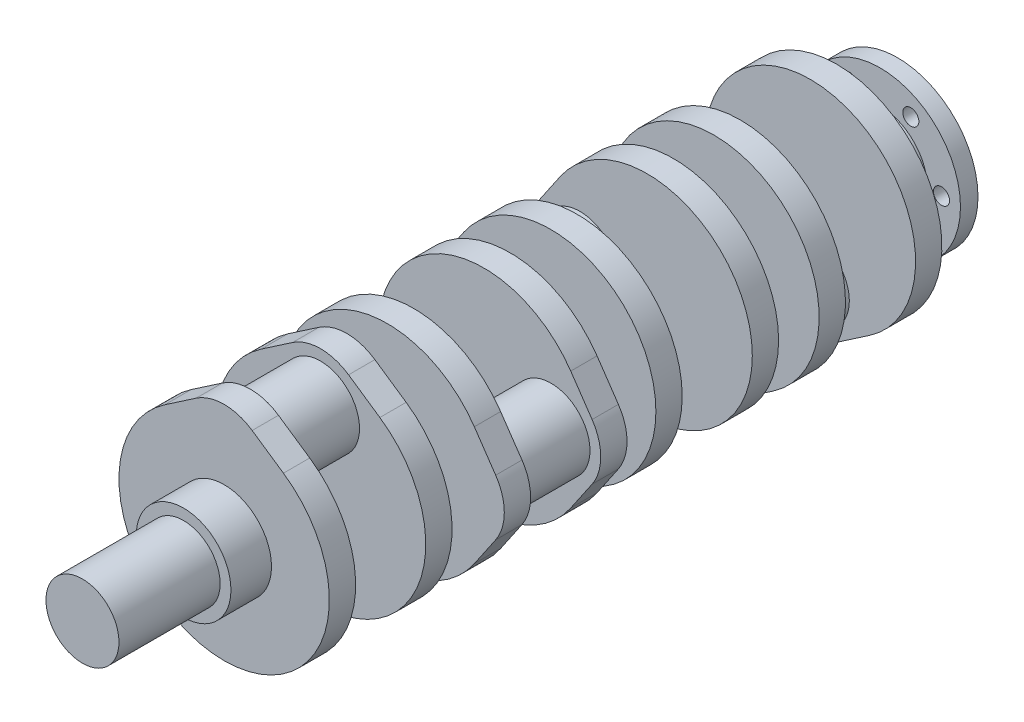
from build123d import *

# Parameters (mm, degrees)
MAIN_START              = 42
SKETCH1_R               = 32.4
MAIN_JOURNAL_1_DEPTH    = 27.76
MAIN_START_2            = -69.76
SKETCH2_R               = 32.4
MAIN_JOURNAL_2_DEPTH    = 27.76
MAIN_START_3            = -181.52
SKETCH3_R               = 32.4
MAIN_JOURNAL_3_DEPTH    = 27.76
MAIN_START_4            = -293.28
SKETCH4_R               = 32.4
MAIN_JOURNAL_4_DEPTH    = 27.76
MAIN_START_5            = -407
SKETCH5_R               = 32.4
MAIN_JOURNAL_5_DEPTH    = 29.72
SNOUT_START             = 69.76
SKETCH6_R               = 25
SNOUT_DEPTH             = 69.24
FLYWHEEL_START          = -419
SKETCH7_R               = 55
FLYWHEEL_FLANGE_DEPTH   = 12
ROD_START               = -24
SKETCH8_R               = 26.65
ROD_JOURNAL_1_DEPTH     = 48
WEB_START               = 24
WEB_1A_DEPTH            = 18
WEB_START_2             = -42
WEB_1B_DEPTH            = 18
ROD_START_2             = -135.76
SKETCH11_R              = 26.65
ROD_JOURNAL_2_DEPTH     = 48
WEB_START_3             = -87.76
WEB_2A_DEPTH            = 18
WEB_START_4             = -153.76
WEB_2B_DEPTH            = 18
ROD_START_3             = -247.52
SKETCH14_R              = 26.65
ROD_JOURNAL_3_DEPTH     = 48
WEB_START_5             = -199.52
WEB_3A_DEPTH            = 18
WEB_START_6             = -265.52
WEB_3B_DEPTH            = 18
ROD_START_4             = -359.28
SKETCH17_R              = 26.65
ROD_JOURNAL_4_DEPTH     = 48
WEB_START_7             = -311.28
WEB_4A_DEPTH            = 18
WEB_START_8             = -377.28
WEB_4B_DEPTH            = 18
FLANGE_START            = -420
SKETCH20_R              = 5.5
FLANGE_BOLT_HOLES_DEPTH = 13


with BuildPart() as part:
    # Sketch1 → Main Journal 1 (new body)
    with BuildSketch(Plane.XY.offset(MAIN_START)):
        Circle(SKETCH1_R)
    extrude(amount=MAIN_JOURNAL_1_DEPTH)

    # Sketch6 → Snout (add)
    with BuildSketch(Plane.XY.offset(SNOUT_START)):
        Circle(SKETCH6_R)
    extrude(amount=SNOUT_DEPTH)



with BuildPart() as body_2:
    # Sketch2 → Main Journal 2 (new body)
    with BuildSketch(Plane.XY.offset(MAIN_START_2)):
        Circle(SKETCH2_R)
    extrude(amount=MAIN_JOURNAL_2_DEPTH)


with BuildPart() as body_3:
    # Sketch3 → Main Journal 3 (new body)
    with BuildSketch(Plane.XY.offset(MAIN_START_3)):
        Circle(SKETCH3_R)
    extrude(amount=MAIN_JOURNAL_3_DEPTH)


with BuildPart() as body_4:
    # Sketch4 → Main Journal 4 (new body)
    with BuildSketch(Plane.XY.offset(MAIN_START_4)):
        Circle(SKETCH4_R)
    extrude(amount=MAIN_JOURNAL_4_DEPTH)


with BuildPart() as body_5:
    # Sketch5 → Main Journal 5 (new body)
    with BuildSketch(Plane.XY.offset(MAIN_START_5)):
        Circle(SKETCH5_R)
    extrude(amount=MAIN_JOURNAL_5_DEPTH)

    # Sketch7 → Flywheel Flange (add)
    with BuildSketch(Plane.XY.offset(FLYWHEEL_START)):
        Circle(SKETCH7_R)
    extrude(amount=FLYWHEEL_FLANGE_DEPTH)


with BuildPart() as body_6:
    # Sketch8 → Rod Journal 1 (new body)
    with BuildSketch(Plane.XY.offset(ROD_START)):
        with Locations((0, 46)):
            Circle(SKETCH8_R)
    extrude(amount=ROD_JOURNAL_1_DEPTH)


with BuildPart() as part_1:
    add(part.part)

    add(body_6.part)  # Web 1A merges body 6
    # Sketch9 → Web 1A (add)
    with BuildSketch(Plane.XY.offset(WEB_START)):
        with BuildLine():
            Line((19.160450761, 74.086956522), (40.575072199, 59.47826087))
            ThreePointArc((40.575072199, 59.47826087), (0, -72), (-40.575072199, 59.47826087))
            Line((-40.575072199, 59.47826087), (-19.160450761, 74.086956522))
            ThreePointArc((-19.160450761, 74.086956522), (0, 80), (19.160450761, 74.086956522))
        make_face()
    extrude(amount=WEB_1A_DEPTH)


    add(body_2.part)  # Web 1B merges body 2
    # Sketch10 → Web 1B (add)
    with BuildSketch(Plane.XY.offset(WEB_START_2)):
        with BuildLine():
            Line((19.160450761, 74.086956522), (40.575072199, 59.47826087))
            ThreePointArc((40.575072199, 59.47826087), (0, -72), (-40.575072199, 59.47826087))
            Line((-40.575072199, 59.47826087), (-19.160450761, 74.086956522))
            ThreePointArc((-19.160450761, 74.086956522), (0, 80), (19.160450761, 74.086956522))
        make_face()
    extrude(amount=WEB_1B_DEPTH)



with BuildPart() as body_5_2:
    # Sketch11 → Rod Journal 2 (new body)
    with BuildSketch(Plane.XY.offset(ROD_START_2)):
        with Locations((46, 0)):
            Circle(SKETCH11_R)
    extrude(amount=ROD_JOURNAL_2_DEPTH)


with BuildPart() as part_2:
    add(part_1.part)

    add(body_5_2.part)  # Web 2A merges body 5 2
    # Sketch12 → Web 2A (add)
    with BuildSketch(Plane.XY.offset(WEB_START_3)):
        with BuildLine():
            Line((74.086956522, -19.160450761), (59.47826087, -40.575072199))
            ThreePointArc((59.47826087, -40.575072199), (-72, 0), (59.47826087, 40.575072199))
            Line((59.47826087, 40.575072199), (74.086956522, 19.160450761))
            ThreePointArc((74.086956522, 19.160450761), (80, 0), (74.086956522, -19.160450761))
        make_face()
    extrude(amount=WEB_2A_DEPTH)


    add(body_3.part)  # Web 2B merges body 3
    # Sketch13 → Web 2B (add)
    with BuildSketch(Plane.XY.offset(WEB_START_4)):
        with BuildLine():
            Line((74.086956522, -19.160450761), (59.47826087, -40.575072199))
            ThreePointArc((59.47826087, -40.575072199), (-72, 0), (59.47826087, 40.575072199))
            Line((59.47826087, 40.575072199), (74.086956522, 19.160450761))
            ThreePointArc((74.086956522, 19.160450761), (80, 0), (74.086956522, -19.160450761))
        make_face()
    extrude(amount=WEB_2B_DEPTH)



with BuildPart() as body_4_2:
    # Sketch14 → Rod Journal 3 (new body)
    with BuildSketch(Plane.XY.offset(ROD_START_3)):
        with Locations((-46, 0)):
            Circle(SKETCH14_R)
    extrude(amount=ROD_JOURNAL_3_DEPTH)


with BuildPart() as part_3:
    add(part_2.part)

    add(body_4_2.part)  # Web 3A merges body 4 2
    # Sketch15 → Web 3A (add)
    with BuildSketch(Plane.XY.offset(WEB_START_5)):
        with BuildLine():
            Line((-74.086956522, 19.160450761), (-59.47826087, 40.575072199))
            ThreePointArc((-59.47826087, 40.575072199), (72, 0), (-59.47826087, -40.575072199))
            Line((-59.47826087, -40.575072199), (-74.086956522, -19.160450761))
            ThreePointArc((-74.086956522, -19.160450761), (-80, 0), (-74.086956522, 19.160450761))
        make_face()
    extrude(amount=WEB_3A_DEPTH)


    add(body_4.part)  # Web 3B merges body 4
    # Sketch16 → Web 3B (add)
    with BuildSketch(Plane.XY.offset(WEB_START_6)):
        with BuildLine():
            Line((-74.086956522, 19.160450761), (-59.47826087, 40.575072199))
            ThreePointArc((-59.47826087, 40.575072199), (72, 0), (-59.47826087, -40.575072199))
            Line((-59.47826087, -40.575072199), (-74.086956522, -19.160450761))
            ThreePointArc((-74.086956522, -19.160450761), (-80, 0), (-74.086956522, 19.160450761))
        make_face()
    extrude(amount=WEB_3B_DEPTH)



with BuildPart() as body_3_2:
    # Sketch17 → Rod Journal 4 (new body)
    with BuildSketch(Plane.XY.offset(ROD_START_4)):
        with Locations((0, -46)):
            Circle(SKETCH17_R)
    extrude(amount=ROD_JOURNAL_4_DEPTH)


with BuildPart() as part_4:
    add(part_3.part)

    add(body_3_2.part)  # Web 4A merges body 3 2
    # Sketch18 → Web 4A (add)
    with BuildSketch(Plane.XY.offset(WEB_START_7)):
        with BuildLine():
            Line((-19.160450761, -74.086956522), (-40.575072199, -59.47826087))
            ThreePointArc((-40.575072199, -59.47826087), (0, 72), (40.575072199, -59.47826087))
            Line((40.575072199, -59.47826087), (19.160450761, -74.086956522))
            ThreePointArc((19.160450761, -74.086956522), (0, -80), (-19.160450761, -74.086956522))
        make_face()
    extrude(amount=WEB_4A_DEPTH)


    add(body_5.part)  # Web 4B merges body 5
    # Sketch19 → Web 4B (add)
    with BuildSketch(Plane.XY.offset(WEB_START_8)):
        with BuildLine():
            Line((-19.160450761, -74.086956522), (-40.575072199, -59.47826087))
            ThreePointArc((-40.575072199, -59.47826087), (0, 72), (40.575072199, -59.47826087))
            Line((40.575072199, -59.47826087), (19.160450761, -74.086956522))
            ThreePointArc((19.160450761, -74.086956522), (0, -80), (-19.160450761, -74.086956522))
        make_face()
    extrude(amount=WEB_4B_DEPTH)

    # Sketch20 → Flange Bolt Holes (cut)
    with BuildSketch(Plane.XY.offset(FLANGE_START)):
        with Locations((42, 0)):
            Circle(SKETCH20_R)
        with Locations((21, 36.373066959)):
            Circle(SKETCH20_R)
        with Locations((-21, 36.373066959)):
            Circle(SKETCH20_R)
        with Locations((-42, 0)):
            Circle(SKETCH20_R)
        with Locations((-21, -36.373066959)):
            Circle(SKETCH20_R)
        with Locations((21, -36.373066959)):
            Circle(SKETCH20_R)
    extrude(amount=FLANGE_BOLT_HOLES_DEPTH, mode=Mode.SUBTRACT)


solid = part_4.part
